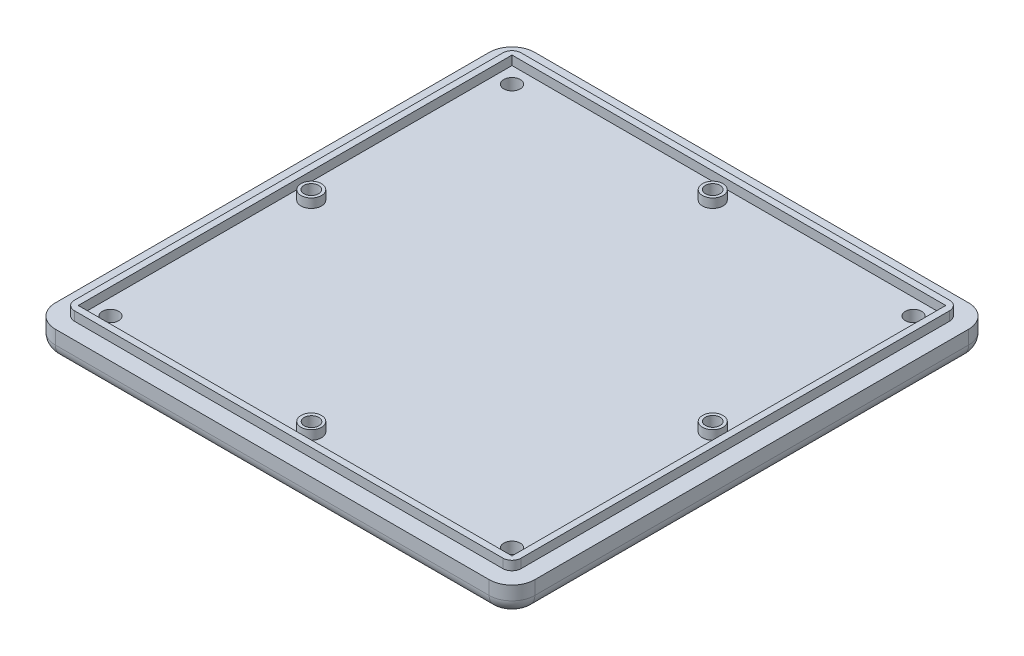
from build123d import *

# Parameters (mm, degrees)
BOSS_EXTRUDE1_DEPTH                             = 6
FILLET1_R                                       = 3
CSK_FOR_M3_FLAT_HEAD_MACHINE_SCREW1_D           = 3.6
CSK_FOR_M3_FLAT_HEAD_MACHINE_SCREW1_CSINK_D     = 6.3
CSK_FOR_M3_FLAT_HEAD_MACHINE_SCREW1_CSINK_ANGLE = 90
BOSS_EXTRUDE2_DEPTH                             = 2
SKETCH6_R                                       = 2.25
BOSS_EXTRUDE3_DEPTH                             = 2
M3_CLEARANCE_HOLE1_D                            = 3.2
M3_CLEARANCE_HOLE1_DEPTH                        = 5
M3_CLEARANCE_HOLE1_TIP                          = 0.96137699


with BuildPart() as part:
    # Sketch1 → Boss-Extrude1 (new body)
    with BuildSketch(Plane(origin=(0, 0, 0), x_dir=(1, 0, 0), z_dir=(0, 1, 0))):
        with BuildLine():
            Line((5, 0), (100, 0))
            ThreePointArc((100, 0), (103.535533906, 1.464466094), (105, 5))
            Line((105, 5), (105, 100))
            ThreePointArc((105, 100), (103.535533906, 103.535533906), (100, 105))
            Line((100, 105), (5, 105))
            ThreePointArc((5, 105), (1.464466094, 103.535533906), (0, 100))
            Line((0, 100), (0, 5))
            ThreePointArc((0, 5), (1.464466094, 1.464466094), (5, 0))
        make_face()
    extrude(amount=BOSS_EXTRUDE1_DEPTH)

    # Fillet1
    fillet1_edges = [part.edges().sort_by_distance(p)[0] for p in [
        (1.464466094, 0, -103.535533906),
        (52.5, 0, -105),
        (103.535533906, 0, -103.535533906),
        (105, 0, -52.5),
        (103.535533906, 0, -1.464466094),
        (1.464466094, 0, -1.464466094),
        (0, 0, -52.5),
        (52.5, 0, 0),
    ]]
    fillet(fillet1_edges, radius=FILLET1_R)

    # CSK for M3 Flat Head Machine Screw1 (through all)
    with Locations(Plane(origin=(8.535533906, 0, -8.535533906), x_dir=(0, 0, -1), z_dir=(0, -1, 0))):
        with Locations((0, 0), (87.928932188, 0), (87.928932188, 87.928932188), (0, 87.928932188)):
            CounterSinkHole(CSK_FOR_M3_FLAT_HEAD_MACHINE_SCREW1_D / 2, CSK_FOR_M3_FLAT_HEAD_MACHINE_SCREW1_CSINK_D / 2, counter_sink_angle=CSK_FOR_M3_FLAT_HEAD_MACHINE_SCREW1_CSINK_ANGLE)

    # Sketch5 → Boss-Extrude2 (add)
    with BuildSketch(Plane(origin=(0, 6, 0), x_dir=(1, 0, 0), z_dir=(0, 1, 0))):
        with BuildLine():
            ThreePointArc((3.585786438, 5.585786438), (3.738027373, 4.820419573), (4.171572875, 4.171572875))
            ThreePointArc((4.171572875, 4.171572875), (4.820419573, 3.738027373), (5.585786438, 3.585786438))
            Line((5.585786438, 3.585786438), (99.414213562, 3.585786438))
            ThreePointArc((99.414213562, 3.585786438), (100.828427125, 4.171572875), (101.414213562, 5.585786438))
            Line((101.414213562, 5.585786438), (101.414213562, 99.414213562))
            ThreePointArc((101.414213562, 99.414213562), (100.828427125, 100.828427125), (99.414213562, 101.414213562))
            Line((99.414213562, 101.414213562), (5.585786438, 101.414213562))
            ThreePointArc((5.585786438, 101.414213562), (4.171572875, 100.828427125), (3.585786438, 99.414213562))
            Line((3.585786438, 99.414213562), (3.585786438, 5.585786438))
        make_face()
        Polygon((98, 5), (7, 5), (5, 5), (5, 7), (5, 98), (5, 100), (7, 100), (98, 100), (100, 100), (100, 98), (100, 7), (100, 5), align=None, mode=Mode.SUBTRACT)
    extrude(amount=BOSS_EXTRUDE2_DEPTH)

    # Sketch6 → Boss-Extrude3 (add)
    with BuildSketch(Plane(origin=(0, 6, 0), x_dir=(1, 0, 0), z_dir=(0, 1, 0))):
        with Locations((8.535533906, 52.5)):
            Circle(SKETCH6_R)
        with Locations((52.5, 8.535533906)):
            Circle(SKETCH6_R)
        with Locations((96.464466094, 52.5)):
            Circle(SKETCH6_R)
        with Locations((52.5, 96.464466094)):
            Circle(SKETCH6_R)
    extrude(amount=BOSS_EXTRUDE3_DEPTH)

    # M3 Clearance Hole1
    with Locations(Plane(origin=(8.535533906, 8, -52.5), x_dir=(0, 0, 1), z_dir=(0, 1, 0))):
        with Locations((0, 0), (43.983643016, 44.044146607), (0, 87.928932188), (-43.964466094, 43.964466094)):
            Hole(M3_CLEARANCE_HOLE1_D / 2, depth=M3_CLEARANCE_HOLE1_DEPTH)
            with Locations((0, 0, -(M3_CLEARANCE_HOLE1_DEPTH + M3_CLEARANCE_HOLE1_TIP / 2))):  # 118° drill point
                Cone(0, M3_CLEARANCE_HOLE1_D / 2, M3_CLEARANCE_HOLE1_TIP, mode=Mode.SUBTRACT)


solid = part.part
